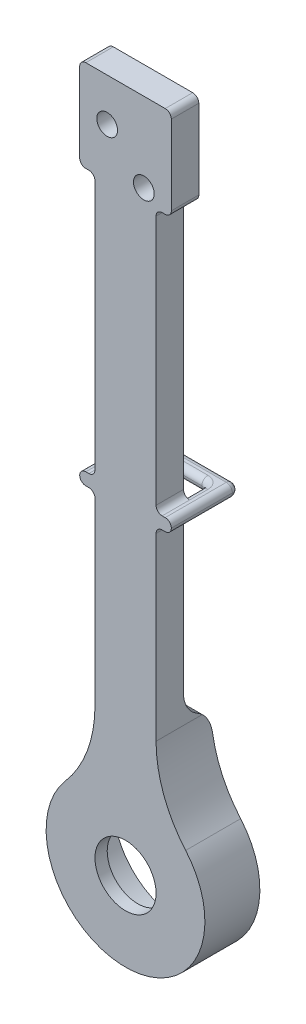
from build123d import *

# Parameters (mm, degrees)
SKETCH1_R               = 13
SKETCH1_R_2             = 5
SKETCH1_W               = 10
SKETCH1_H               = 100
SKETCH1_W_2             = 15
SKETCH1_H_2             = 15
BOSS_EXTRUDE1_DEPTH     = 4.5
SKETCH2_R               = 11
CUT_EXTRUDE1_DEPTH      = 7
FILLET7_R               = 1
FILLET1_R               = 20
CUT_EXTRUDE2_DEPTH      = 113.841703284
CUT_EXTRUDE2_DEPTH_BACK = 113.841703284
SKETCH3_W               = 4.5
SKETCH3_H               = 90.459340771
M3_CLEARANCE_HOLE1_D    = 3.4
FILLET5_R               = 4.5
FILLET6_R               = 4.5
BOSS_EXTRUDE2_DEPTH     = 2
FILLET8_R               = 1
FILLET9_R               = 1


# Some blends are built 0.0001 mm under size
with BuildPart() as part:
    # Sketch1 → Boss-Extrude1 (new, symmetric)
    # profile 1 of 3: a face of its own
    with BuildSketch(Plane.XY):
        Circle(SKETCH1_R)
        Circle(SKETCH1_R_2, mode=Mode.SUBTRACT)
    # profile 2 of 3: a face of its own
    with BuildSketch(Plane.XY):
        with Locations((0, 62)):
            Rectangle(SKETCH1_W, SKETCH1_H)
    # profile 3 of 3: a face of its own
    with BuildSketch(Plane.XY):
        with Locations((0, 104.5)):
            Rectangle(SKETCH1_W_2, SKETCH1_H_2)
    extrude(amount=BOSS_EXTRUDE1_DEPTH, both=True)

    # Sketch2 → Cut-Extrude1 (cut)
    with BuildSketch(Plane(origin=(0, 0, -4.5), x_dir=(-1, 0, 0), z_dir=(0, 0, -1))):
        Circle(SKETCH2_R)
    extrude(amount=-CUT_EXTRUDE1_DEPTH, mode=Mode.SUBTRACT)

    # Fillet7
    fillet7_edges = [part.edges().sort_by_distance(p)[0] for p in [
        (-5, 97, 0),
        (5, 97, 0),
        (7.5, 97, 0),
        (7.5, 112, 0),
        (-7.5, 112, 0),
        (-7.5, 97, 0),
    ]]
    fillet(fillet7_edges, radius=FILLET7_R)

    # Fillet1
    fillet1_edges = [part.edges().sort_by_distance(p)[0] for p in [
        (-5, 12, 0),
        (5, 12, 0),
    ]]
    fillet(fillet1_edges, radius=FILLET1_R)

    # Sketch3 → Cut-Extrude2 (cut, two sides: drawn at the far end of the back side and taken through both)
    with BuildSketch(Plane(origin=(0, 0, 0), x_dir=(0, 0, -1), z_dir=(1, 0, 0)).offset(-CUT_EXTRUDE2_DEPTH_BACK)):
        with Locations((2.25, 66.770329614)):
            Rectangle(SKETCH3_W, SKETCH3_H)
    extrude(amount=CUT_EXTRUDE2_DEPTH + CUT_EXTRUDE2_DEPTH_BACK, mode=Mode.SUBTRACT)

    # M3 Clearance Hole1 (through all)
    with Locations(Plane.XY.offset(4.5)):
        with Locations((3, 99), (-3, 105)):
            Hole(M3_CLEARANCE_HOLE1_D / 2)

    # Fillet5
    fillet5_edges = [part.edges().sort_by_distance(p)[0] for p in [
        (0, 21.540659229, 0),
    ]]
    fillet(fillet5_edges, radius=FILLET5_R - 0.0001)  # a hair under: the kernel refuses the full size

    # Fillet6
    # the kernel refuses this fillet: 4.5 mm, written as the material it takes off along each edge
    with BuildSketch(Plane(origin=(-13.235677247, 21.540659229, -4.5), x_dir=(0, -1, 0), z_dir=(1, 0, 0))) as fillet6_piece_1:
        with BuildLine():
            CenterArc((3.294270899, -4.5), FILLET6_R, 90, 60.000367556)
            Line((-0.602857852, -2.250025), (-0.992570727, -2.0250275))
            ThreePointArc((-0.992570727, -2.0250275), (-0.45, -0.0001), (-0.45, 0))
            Line((-0.45, 0), (0, 0.45))
            Line((0, 0.45), (3.294270899, 0.45))
            Line((3.294270899, 0.45), (3.294270899, 0))
        make_face()
    extrude(amount=26.471354494, mode=Mode.SUBTRACT)

    # Sketch10 → Boss-Extrude2 (add)
    with BuildSketch(Plane(origin=(0, 52, 0), x_dir=(-1, 0, 0), z_dir=(0, -1, 0))):
        Polygon((5, -4.5), (7.5, -4.5), (7.5, 6.5), (-7.5, 6.5), (-7.5, -4.5), (-5, -4.5), (-5, 4), (5, 4), align=None)
    extrude(amount=-BOSS_EXTRUDE2_DEPTH)

    # Fillet8
    fillet8_edges = [part.edges().sort_by_distance(p)[0] for p in [
        (-5, 52, -2),
        (5, 54, -2),
        (5, 53, -4),
        (7.5, 52, -1),
        (0, 54, -6.5),
        (7.5, 53, -6.5),
        (-7.5, 54, -1),
        (-7.5, 53, -6.5),
        (0, 52, -4),
        (-5, 53, -4),
        (7.5, 54, -1),
        (-5, 54, -2),
        (0, 54, -4),
        (5, 52, -2),
        (-7.5, 52, -1),
        (0, 52, -6.5),
    ]]
    fillet(fillet8_edges, radius=FILLET8_R - 0.0001)  # a hair under: the kernel refuses the full size

    # Fillet9
    fillet9_edges = [part.edges().sort_by_distance(p)[0] for p in [
        (5, 54, 2.25),
        (-5, 54, 2.25),
        (-5, 52, 2.25),
        (5, 52, 2.25),
    ]]
    fillet(fillet9_edges, radius=FILLET9_R - 0.0001)  # a hair under: the kernel refuses the full size


solid = part.part
